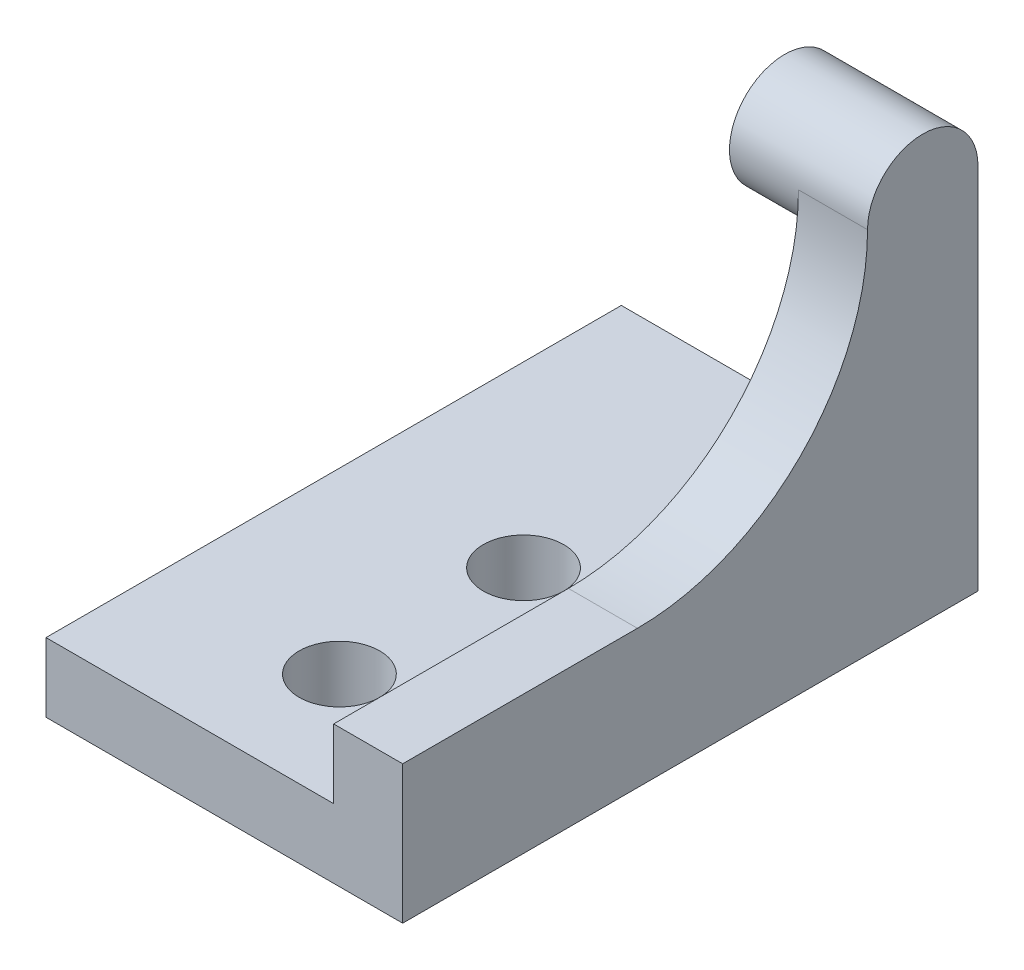
from build123d import *

# Parameters (mm, degrees)
ESQUISSE1_R        = 2.4
BOSS_EXTRU_1_DEPTH = 3
BOSS_EXTRU_2_DEPTH = 3
ESQUISSE3_W        = 15.5
ESQUISSE3_H        = 25
ESQUISSE3_R        = 1.75
BOSS_EXTRU_3_DEPTH = 3


with BuildPart() as part:
    # Esquisse1 → Boss.-Extru.1 (new body)
    with BuildSketch(Plane(origin=(0, 0, 0), x_dir=(0, 0, -1), z_dir=(1, 0, 0))):
        Circle(ESQUISSE1_R)
    extrude(amount=BOSS_EXTRU_1_DEPTH)

    # Esquisse2 → Boss.-Extru.2 (add)
    with BuildSketch(Plane(origin=(3, 0, 0), x_dir=(0, 0, -1), z_dir=(1, 0, 0))):
        with BuildLine():
            Line((-2.4, -13), (-22.6, -13))
            Line((-22.6, -13), (-22.6, -10))
            Line((-22.6, -10), (-12.4, -10))
            ThreePointArc((-12.4, -10), (-5.328932188, -7.071067812), (-2.4, 0))
            ThreePointArc((-2.4, 0), (0, 2.4), (2.4, 0))
            Line((2.4, 0), (2.4, -13))
            Line((2.4, -13), (-2.4, -13))
        make_face()
    extrude(amount=BOSS_EXTRU_2_DEPTH)

    # Esquisse3 → Boss.-Extru.3 (add)
    with BuildSketch(Plane.XZ.offset(13)):
        with Locations((-1.75, 10.1)):
            Rectangle(ESQUISSE3_W, ESQUISSE3_H)
        with Locations((-1.75, 9.6)):
            Circle(ESQUISSE3_R, mode=Mode.SUBTRACT)
        with Locations((-1.75, 17.6)):
            Circle(ESQUISSE3_R, mode=Mode.SUBTRACT)
    extrude(amount=BOSS_EXTRU_3_DEPTH)


solid = part.part
